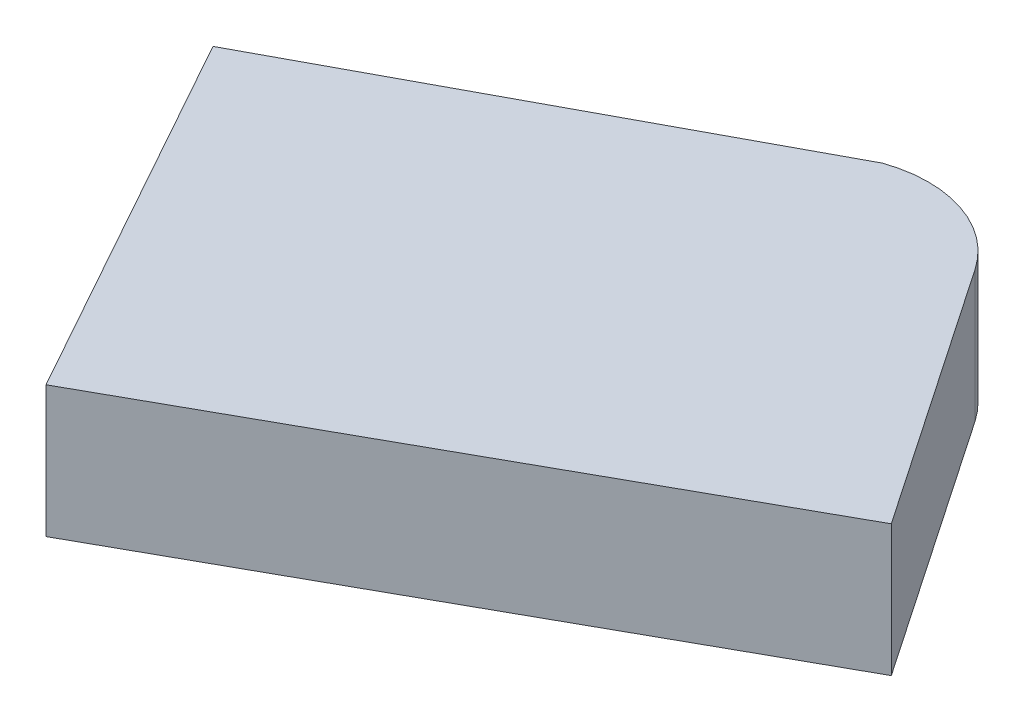
from build123d import *

# Parameters (mm, degrees)
BOSS_EXTRUDE1_DEPTH = 27.94
CUT_EXTRUDE1_DEPTH  = 25.4


with BuildPart() as part:
    # Sketch1 → Boss-Extrude1 (new body)
    with BuildSketch(Plane(origin=(0, 0, 0), x_dir=(1, 0, 0), z_dir=(0, 1, 0))):
        with BuildLine():
            Line((91.4129868, -1.640528995), (53.472774534, 54.106304547))
            ThreePointArc((53.472774534, 54.106304547), (40.413563129, 63.94269541), (24.065106775, 63.782812478))
            Line((24.065106775, 63.782812478), (-68.530354145, 14.145625935))
            Line((-68.530354145, 14.145625935), (-23.997175052, -65.871525727))
            Line((-23.997175052, -65.871525727), (91.4129868, -1.640528995))
        make_face()
    extrude(amount=BOSS_EXTRUDE1_DEPTH)

    # Sketch1<6> → Cut-Extrude1 (cut)
    with BuildSketch(Plane(origin=(0, 0, 0), x_dir=(1, 0, 0), z_dir=(0, 1, 0))):
        with BuildLine():
            Line((25.087132092, 61.448746164), (-65.05607828, 13.126125331))
            Line((-65.05607828, 13.126125331), (-23.012960338, -62.416888062))
            Line((-23.012960338, -62.416888062), (87.74972582, -0.772422632))
            Line((87.74972582, -0.772422632), (51.37294826, 52.677203564))
            ThreePointArc((51.37294826, 52.677203564), (39.71060859, 61.499816926), (25.087132092, 61.448746164))
        make_face()
    extrude(amount=CUT_EXTRUDE1_DEPTH, mode=Mode.SUBTRACT)


solid = part.part
